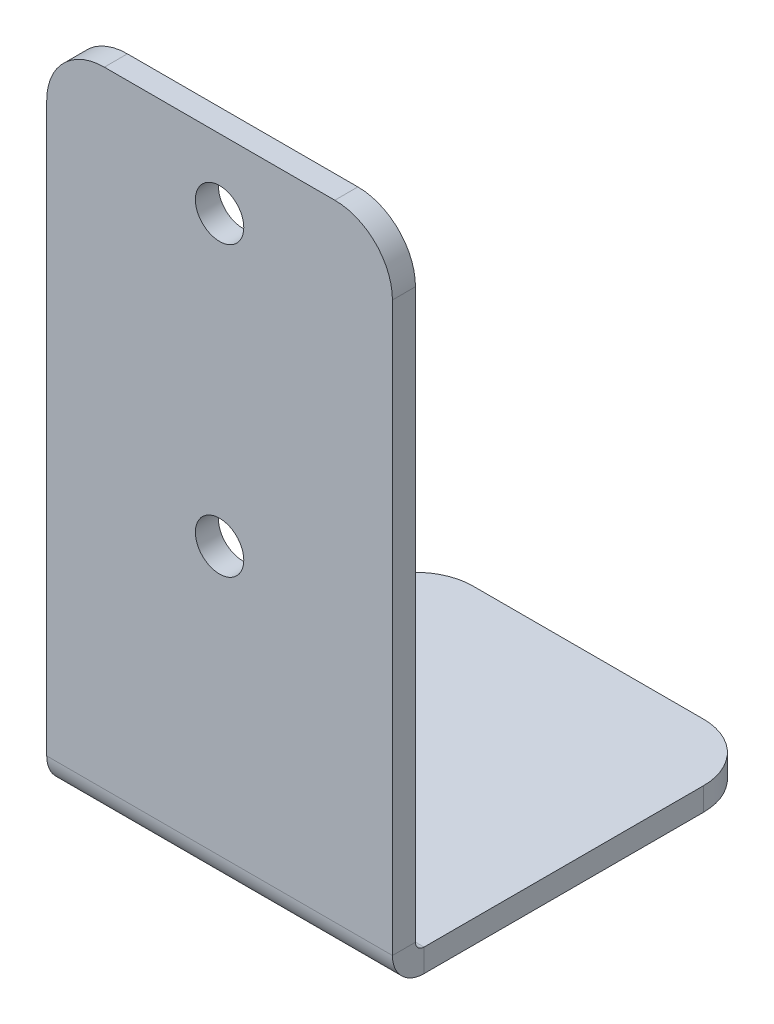
from build123d import *

# Parameters (mm, degrees)
TABAN_FLAN_1_DEPTH   = 15
M5_DI_LI_DELIK1_D    = 4.2
K_ELERI_START        = -57
K_ELERI_K_R1_DEPTH   = 2
K_ELERI_K_R1_2_DEPTH = 2


# Read off the part's stored shape, not the designer's step: Köşeleri kır1
# Sheet-metal steps are written as plain solids
with BuildPart() as part:
    # Çizim1 → Taban-Flanş1 (new, symmetric)
    with BuildSketch(Plane(origin=(0, 0, 0), x_dir=(0, 0, -1), z_dir=(1, 0, 0))):
        with BuildLine():
            Line((0, 0), (0, -54.2634))
            ThreePointArc((0, -54.2634), (0.215745145, -54.784254855), (0.7366, -55))
            Line((0.7366, -55), (30, -55))
            Line((30, -55), (30, -57))
            Line((30, -57), (0.7366, -57))
            ThreePointArc((0.7366, -57), (-1.198468417, -56.198468417), (-2, -54.2634))
            Line((-2, -54.2634), (-2, 0))
            Line((-2, 0), (0, 0))
        make_face()
    extrude(amount=TABAN_FLAN_1_DEPTH, both=True)

    # M5 Dişli Delik1 (through all)
    with Locations(Plane(origin=(0, -31, 2), x_dir=(1, 0, 0), z_dir=(0, 0, 1))):
        with Locations((0, 0), (0, 25)):
            Hole(M5_DI_LI_DELIK1_D / 2)

    # Köşeleri kır1 outline → Köşeleri kır1 (cut)
    with BuildSketch(Plane(origin=(0, 0, 0), x_dir=(1, 0, 0), z_dir=(0, 1, 0)).offset(K_ELERI_START)):
        with BuildLine():
            Line((15, 30), (10, 30))
            ThreePointArc((10, 30), (13.535533906, 28.535533906), (15, 25))
            Line((15, 25), (15, 30))
        make_face()
        with BuildLine():
            ThreePointArc((-15, 25), (-13.535533906, 28.535533906), (-10, 30))
            Line((-10, 30), (-15, 30))
            Line((-15, 30), (-15, 25))
        make_face()
    extrude(amount=K_ELERI_K_R1_DEPTH, mode=Mode.SUBTRACT)

    # K_eleri k_r1 2 outline → K_eleri k_r1 2 (cut)
    with BuildSketch(Plane.XY):
        with BuildLine():
            Line((-15, 0), (-15, -5))
            ThreePointArc((-15, -5), (-13.535533906, -1.464466094), (-10, 0))
            Line((-10, 0), (-15, 0))
        make_face()
        with BuildLine():
            Line((15, 0), (10, 0))
            ThreePointArc((10, 0), (13.535533906, -1.464466094), (15, -5))
            Line((15, -5), (15, 0))
        make_face()
    extrude(amount=K_ELERI_K_R1_2_DEPTH, mode=Mode.SUBTRACT)


solid = part.part
